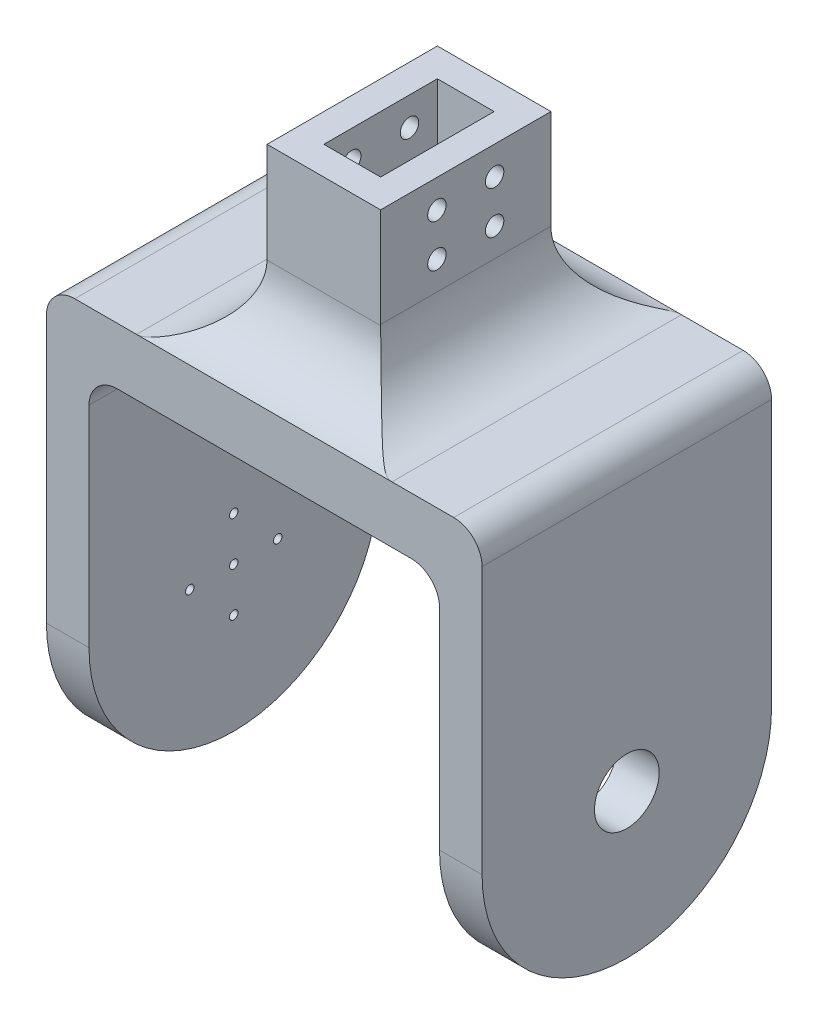
from build123d import *
from build123d.topology import SkipClean

# Parameters (mm, degrees)
SALIENTE_EXTRUIR1_DEPTH = 102
CORTAR_EXTRUIR1_DEPTH   = 241.813724692
CROQUIS3_R              = 1.5
CORTAR_EXTRUIR2_DEPTH   = 30
CROQUIS3_3_R            = 3
CROQUIS3_3_R_2          = 1.5
CORTAR_EXTRUIR3_DEPTH   = 5
CHAFL_N1_SIZE           = 0.4
CROQUIS5_R              = 11.4
CORTAR_EXTRUIR4_DEPTH   = 30
CROQUIS6_W              = 40
CROQUIS6_H              = 60
CROQUIS6_W_2            = 20
CROQUIS6_H_2            = 40
SALIENTE_EXTRUIR2_DEPTH = 60
REDONDEO2_START         = -20
REDONDEO2_DEPTH         = 40
REDONDEO2_START_2       = -5.347e-06
REDONDEO2_2_DEPTH       = 102.000005347
REDONDEO2_START_3       = -76.75
REDONDEO2_3_DEPTH       = 153.5
CROQUIS7_R              = 3.25
CORTAR_EXTRUIR5_DEPTH   = 257.884370664


with BuildPart() as part:
    # Croquis1 → Saliente-Extruir1 (new body)
    with BuildSketch(Plane.XY):
        with BuildLine():
            Line((-61.75, 0), (-76.75, 0))
            Line((-76.75, 0), (-76.75, 145))
            ThreePointArc((-76.75, 145), (-73.821067812, 152.071067812), (-66.75, 155))
            Line((-66.75, 155), (66.75, 155))
            ThreePointArc((66.75, 155), (73.821067812, 152.071067812), (76.75, 145))
            Line((76.75, 145), (76.75, 0))
            Line((76.75, 0), (61.75, 0))
            Line((61.75, 0), (61.75, 125))
            ThreePointArc((61.75, 125), (58.821067812, 132.071067812), (51.75, 135))
            Line((51.75, 135), (-51.75, 135))
            ThreePointArc((-51.75, 135), (-58.821067812, 132.071067812), (-61.75, 125))
            Line((-61.75, 125), (-61.75, 0))
        make_face()
    extrude(amount=SALIENTE_EXTRUIR1_DEPTH)

    # Croquis2 → Cortar-Extruir1 (cut, through all)
    with BuildSketch(Plane.ZY.offset(76.75)):
        with BuildLine():
            ThreePointArc((51, 0), (14.937554159, 14.937554159), (0, 51))
            Line((0, 51), (0, 0))
            Line((0, 0), (51, 0))
        make_face()
        with BuildLine():
            Line((102, 0), (102, 51))
            ThreePointArc((102, 51), (87.062445841, 14.937554159), (51, 0))
            Line((51, 0), (102, 0))
        make_face()
    extrude(amount=-CORTAR_EXTRUIR1_DEPTH, mode=Mode.SUBTRACT)

    # Croquis3 → Cortar-Extruir2 (cut)
    with BuildSketch(Plane.ZY.offset(76.75)):
        with Locations((35.5, 51)):
            Circle(CROQUIS3_R)
        with Locations((51, 66.5)):
            Circle(CROQUIS3_R)
        with Locations((66.5, 51)):
            Circle(CROQUIS3_R)
        with Locations((51, 51)):
            Circle(CROQUIS3_R)
        with Locations((51, 35.5)):
            Circle(CROQUIS3_R)
    extrude(amount=-CORTAR_EXTRUIR2_DEPTH, mode=Mode.SUBTRACT)

    # Croquis3<3> → Cortar-Extruir3 (cut)
    # profile 1 of 4: a face of its own
    with BuildSketch(Plane.ZY.offset(76.75)):
        with Locations((35.5, 51)):
            Circle(CROQUIS3_3_R)
        with Locations((35.5, 51)):
            Circle(CROQUIS3_3_R_2, mode=Mode.SUBTRACT)
    # profile 2 of 4: a face of its own
    with BuildSketch(Plane.ZY.offset(76.75)):
        with Locations((51, 66.5)):
            Circle(CROQUIS3_3_R)
        with Locations((51, 66.5)):
            Circle(CROQUIS3_3_R_2, mode=Mode.SUBTRACT)
    # profile 3 of 4: a face of its own
    with BuildSketch(Plane.ZY.offset(76.75)):
        with Locations((66.5, 51)):
            Circle(CROQUIS3_3_R)
        with Locations((66.5, 51)):
            Circle(CROQUIS3_3_R_2, mode=Mode.SUBTRACT)
    # profile 4 of 4: a face of its own
    with BuildSketch(Plane.ZY.offset(76.75)):
        with Locations((51, 35.5)):
            Circle(CROQUIS3_3_R)
        with Locations((51, 35.5)):
            Circle(CROQUIS3_3_R_2, mode=Mode.SUBTRACT)
    extrude(amount=-CORTAR_EXTRUIR3_DEPTH, mode=Mode.SUBTRACT)

    # Chaflán1
    chafl_n1_edges = [part.edges().sort_by_distance(p)[0] for p in [
        (-76.75, 51, 32.5),
        (-76.75, 66.5, 48),
        (-76.75, 51, 63.5),
        (-76.75, 35.5, 48),
    ]]
    chamfer(chafl_n1_edges, length=CHAFL_N1_SIZE)

    # Croquis5 → Cortar-Extruir4 (cut)
    with BuildSketch(Plane(origin=(76.75, 0, 0), x_dir=(0, 0, -1), z_dir=(1, 0, 0))):
        with Locations((-51, 51)):
            Circle(CROQUIS5_R)
    extrude(amount=-CORTAR_EXTRUIR4_DEPTH, mode=Mode.SUBTRACT)

    # Croquis6 → Saliente-Extruir2 (add)
    with BuildSketch(Plane(origin=(0, 155, 0), x_dir=(1, 0, 0), z_dir=(0, 1, 0))):
        with Locations((0, -51)):
            Rectangle(CROQUIS6_W, CROQUIS6_H)
        with Locations((0, -51)):
            Rectangle(CROQUIS6_W_2, CROQUIS6_H_2, mode=Mode.SUBTRACT)
    extrude(amount=SALIENTE_EXTRUIR2_DEPTH)

    # Redondeo2: read off the stored shape, not the designer's step
    # Redondeo2 outline → Redondeo2 (add)
    with BuildSketch(Plane.YZ.offset(REDONDEO2_START)):
        with BuildLine():
            Line((179.677925359, 21), (155, 21))
            Line((155, 21), (155, 0))
            ThreePointArc((155, 0), (163.476073612, 15.039432765), (179.677925359, 21))
        make_face()
        with BuildLine():
            ThreePointArc((179.677925359, 81), (163.476040765, 86.960595188), (154.999986198, 102.000085152))
            Line((154.999986198, 102.000085152), (155, 81))
            Line((155, 81), (179.677925359, 81))
        make_face()
    extrude(amount=REDONDEO2_DEPTH)

    # Redondeo2 2 outline → Redondeo2 2 (add)
    with BuildSketch(Plane.XY.offset(REDONDEO2_START_2)):
        with BuildLine():
            Line((20, 155), (45, 155))
            ThreePointArc((45, 155), (27.32233047, 162.32233047), (20, 180))
            Line((20, 180), (20, 155))
        make_face()
        with BuildLine():
            Line((-45, 155), (-20, 155))
            Line((-20, 155), (-20, 180))
            ThreePointArc((-20, 180), (-27.32233047, 162.32233047), (-45, 155))
        make_face()
    extrude(amount=REDONDEO2_2_DEPTH)

    # Redondeo2 3 outline → Redondeo2 3 (cut)
    with SkipClean():  # the faces are left unmerged after this step: merging them gives an invalid solid
        with BuildSketch(Plane.YZ.offset(REDONDEO2_START_3)):
            with BuildLine():
                Line((180, 102), (154.999986198, 102.000085152))
                ThreePointArc((154.999986198, 102.000085152), (163.476040765, 86.960595188), (179.677925359, 81))
                Line((179.677925359, 81), (181, 81))
                Line((181, 81), (181, 102))
                Line((181, 102), (180, 102))
            make_face()
            with BuildLine():
                Line((181, -2), (181, 21))
                Line((181, 21), (179.677925359, 21))
                ThreePointArc((179.677925359, 21), (163.476071603, 15.039431055), (154.999999156, -5.21e-06))
                Line((154.999999156, -5.21e-06), (154.67583917, -2))
                Line((154.67583917, -2), (181, -2))
            make_face()
        extrude(amount=REDONDEO2_3_DEPTH, mode=Mode.SUBTRACT)
    add(part.part.scale(1), mode=Mode.REPLACE)  # the faces are merged on a copy

    # Croquis7 → Cortar-Extruir5 (cut, through all)
    with BuildSketch(Plane.ZY.offset(20)):
        with Locations((40.834826991, 205)):
            Circle(CROQUIS7_R)
        with Locations(Location((61.165173009, 205, 0), (0, 0, 180))):
            Circle(CROQUIS7_R)
        with Locations((61.165173009, 190)):
            Circle(CROQUIS7_R)
        with Locations(Location((40.834826991, 190, 0), (0, 0, 180))):
            Circle(CROQUIS7_R)
    extrude(amount=-CORTAR_EXTRUIR5_DEPTH, mode=Mode.SUBTRACT)


solid = part.part
